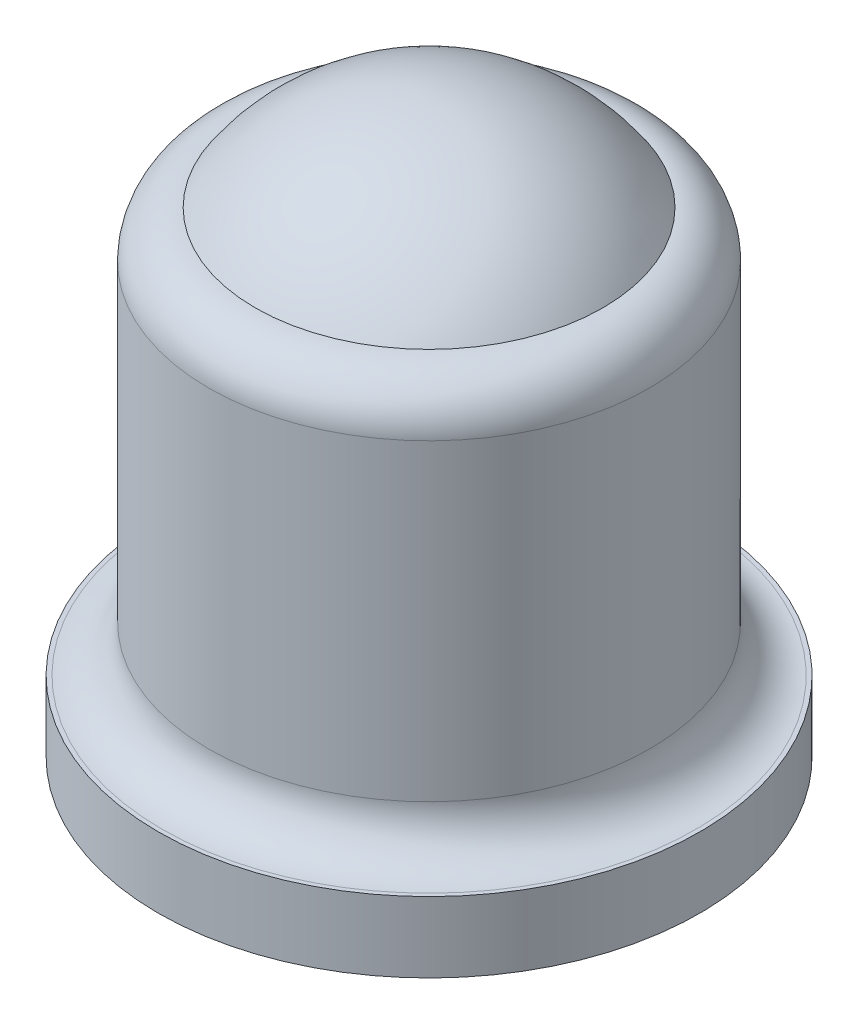
from build123d import *

# Parameters (mm, degrees)
SKETCH1_R           = 2.92
BOSS_EXTRUDE1_DEPTH = 0.76
SKETCH3_R           = 2.375
BOSS_EXTRUDE2_DEPTH = 4.37
FILLET1_R           = 0.5


# Read off the part's stored shape, not the designer's step: Dome1
with BuildPart() as part:
    # Sketch1 → Boss-Extrude1 (new body)
    with BuildSketch(Plane(origin=(0, 0, 0), x_dir=(1, 0, 0), z_dir=(0, 1, 0))):
        with Locations(Location((0, 0, 0), (0, 0, 270))):
            Circle(SKETCH1_R)
    extrude(amount=BOSS_EXTRUDE1_DEPTH)

    # Sketch3 → Boss-Extrude2 (add)
    with BuildSketch(Plane(origin=(0, 0.76, 0), x_dir=(1, 0, 0), z_dir=(0, 1, 0))):
        with Locations(Location((0, 0, 0), (0, 0, 270))):
            Circle(SKETCH3_R)
    extrude(amount=BOSS_EXTRUDE2_DEPTH)

    # Fillet1
    fillet1_edges = [part.edges().sort_by_distance(p)[0] for p in [
        (0, 0.76, -2.375),
        (0, 5.13, -2.375),
    ]]
    fillet(fillet1_edges, radius=FILLET1_R)

    # Dome1 outline → Dome1 (revolve)
    with BuildSketch(Plane.XY):
        with BuildLine():
            Line((0, 5.13), (1.875000001, 5.129999998))
            ThreePointArc((1.875000001, 5.129999998), (1.062500001, 5.864374999), (0, 6.13))
            Line((0, 6.13), (0, 5.13))
        make_face()
    revolve(axis=Axis((0, 0, 0), (0, 1, 0)))


with BuildPart() as body_2:
    # Split1: the piece on the far side of the plane
    add(part.part)
    split(bisect_by=Plane.ZX.offset(5.13), keep=Keep.BOTTOM)


with BuildPart() as part_1:
    add(part.part)

    # Split1
    split(bisect_by=Plane.ZX.offset(5.13), keep=Keep.TOP)


solid = Compound([body_2.part, part_1.part])
